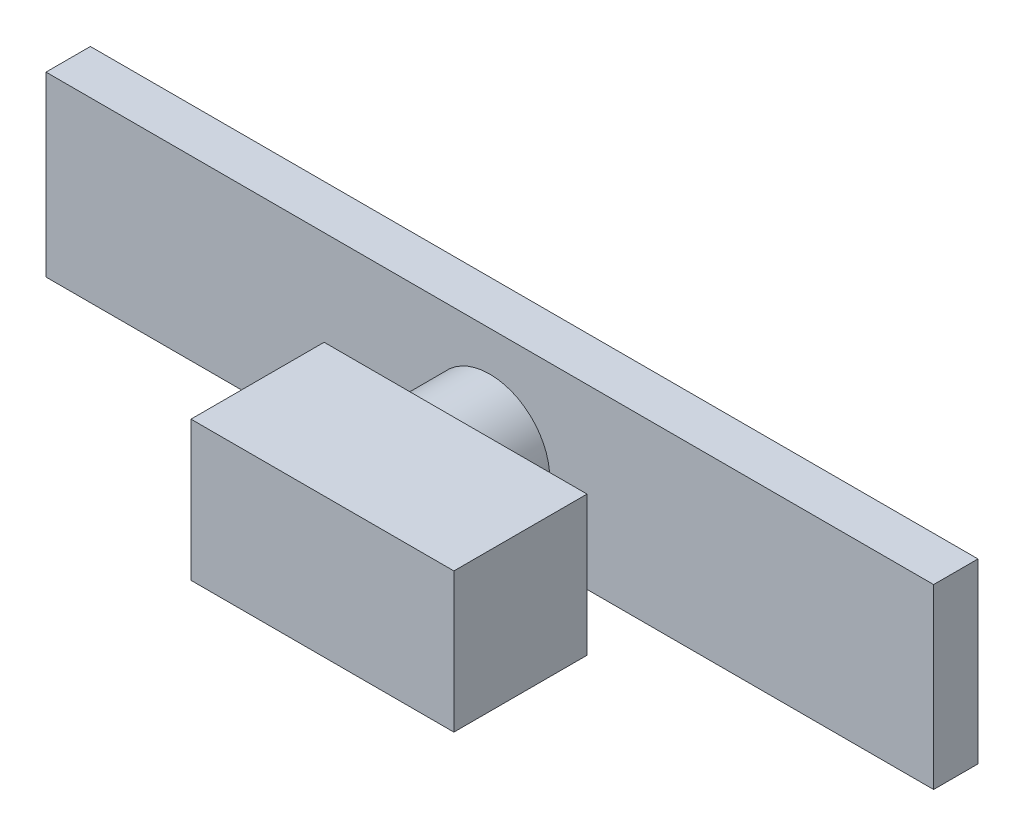
from build123d import *

# Parameters (mm, degrees)
SKETCH2_W             = 254
SKETCH2_H             = 12.7
BOSS_EXTRUDE1_DEPTH   = 50.8
SKETCH3_R             = 17.140791438
BOSS_EXTRUDE2_DEPTH   = 19.05
SKETCH4_W             = 75.235944222
SKETCH4_H             = 39.955088207
BOSS_EXTRUDE3_DEPTH   = 38.1
SCALE2_SCALE          = 0.06
BODY_MOVE_COPY1_ANGLE = 90
SCALE5_SCALE          = 0.25


with BuildPart() as part:
    # Sketch2 → Boss-Extrude1 (new body)
    with BuildSketch(Plane.XY):
        with Locations((79.130769231, 14.898076923)):
            Rectangle(SKETCH2_W, SKETCH2_H)
    extrude(amount=BOSS_EXTRUDE1_DEPTH)

    # Sketch3 → Boss-Extrude2 (add)
    with BuildSketch(Plane(origin=(0, 21.248076923, 0), x_dir=(1, 0, 0), z_dir=(0, 1, 0))):
        with Locations((79.130769231, -28.483063876)):
            Circle(SKETCH3_R)
    extrude(amount=BOSS_EXTRUDE2_DEPTH)

    # Sketch4 → Boss-Extrude3 (add)
    with BuildSketch(Plane(origin=(0, 40.298076923, 0), x_dir=(1, 0, 0), z_dir=(0, 1, 0))):
        with Locations((88.38546847, -28.088530296)):
            Rectangle(SKETCH4_W, SKETCH4_H)
    extrude(amount=BOSS_EXTRUDE3_DEPTH)


with BuildPart() as part_1:
    # Scale2: scaled about (82.711857342, 33.041003565, 26.623476887)
    add(part.part.scale(SCALE2_SCALE).moved(Location((77.749145901, 31.058543351, 25.026068274))))


with BuildPart() as part_2:
    # Body-Move/Copy1: moved
    add(part_1.part.rotate(Axis((0, 33.666927966, 26.550068274), (1, 0, 0)), BODY_MOVE_COPY1_ANGLE))


with BuildPart() as part_3:
    # Body-Move/Copy3: moved
    add(part_2.part.moved(Location((-50.8, 0, -50.8))))


with BuildPart() as part_4:
    # Scale5: scaled about (31.911857342, 33.593519353, -24.875856127)
    add(part_3.part.scale(SCALE5_SCALE).moved(Location((23.933893006, 25.195139515, -18.656892095))))


with BuildPart() as part_5:
    # Body-Move/Copy6: moved
    add(part_4.part.moved(Location((50.8, 0, 0))))


solid = part_5.part
